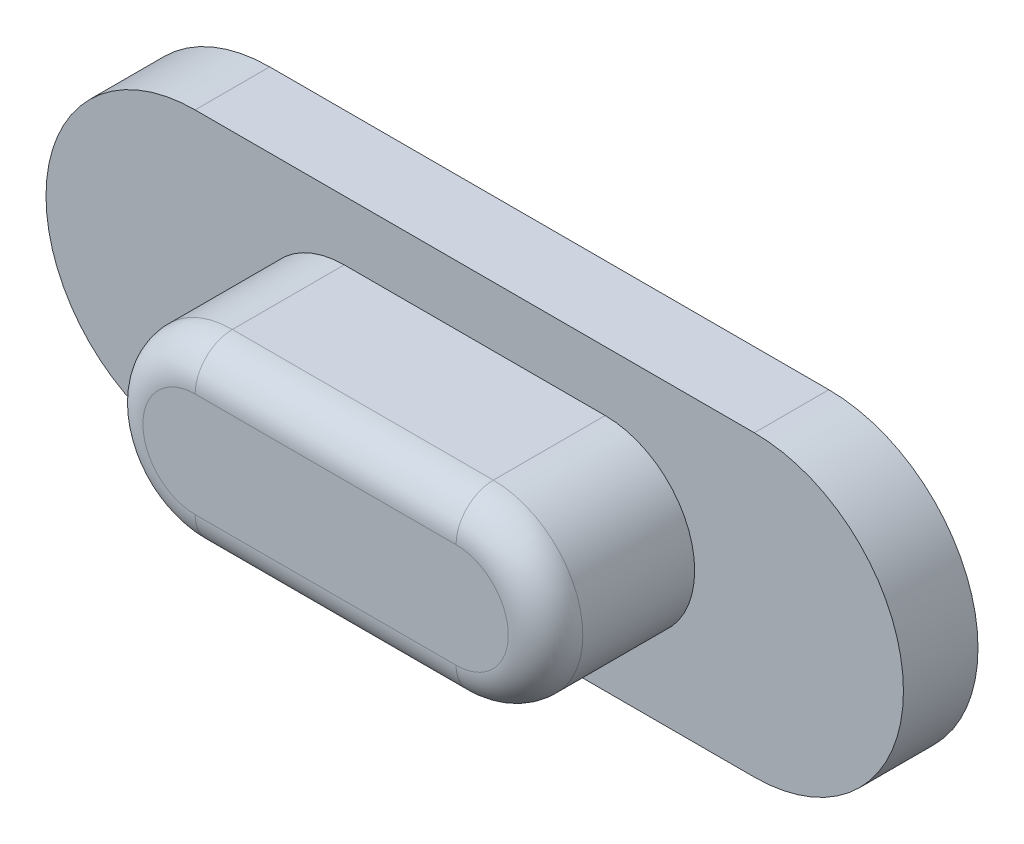
from build123d import *

# Parameters (mm, degrees)
EXTRUDE_1_DEPTH = 2
EXTRUDE_2_DEPTH = 1
FILLET_1_R      = 0.5


with BuildPart() as part:
    # 草图1 → 凸台-拉伸1 (new body)
    with BuildSketch(Plane.XY):
        with BuildLine():
            Line((1.25, 2.45), (4.75, 2.45))
            ThreePointArc((4.75, 2.45), (5.95, 1.25), (4.75, 0.05))
            Line((4.75, 0.05), (1.25, 0.05))
            ThreePointArc((1.25, 0.05), (0.05, 1.25), (1.25, 2.45))
        make_face()
    extrude(amount=EXTRUDE_1_DEPTH)

    # 草图2 → 凸台-拉伸2 (add)
    with BuildSketch(Plane(origin=(0, 0, 0), x_dir=(-1, 0, 0), z_dir=(0, 0, -1))):
        with BuildLine():
            Line((-6.75, -0.75), (0.75, -0.75))
            ThreePointArc((0.75, -0.75), (2.75, 1.25), (0.75, 3.25))
            Line((0.75, 3.25), (-6.75, 3.25))
            ThreePointArc((-6.75, 3.25), (-8.75, 1.25), (-6.75, -0.75))
        make_face()
    extrude(amount=EXTRUDE_2_DEPTH)

    # 圆角1
    fillet_1_edges = [part.edges().sort_by_distance(p)[0] for p in [
        (0.05, 1.25, 2),
        (3, 0.05, 2),
        (5.95, 1.25, 2),
        (3, 2.45, 2),
    ]]
    fillet(fillet_1_edges, radius=FILLET_1_R)


solid = part.part
